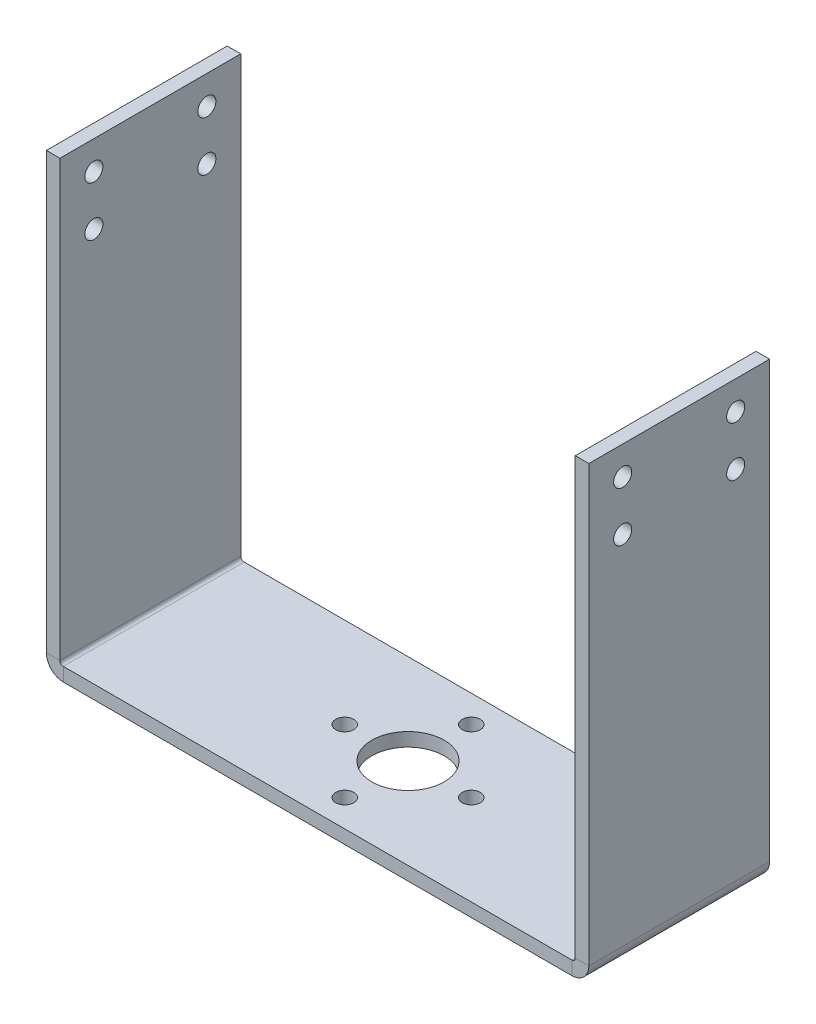
from build123d import *

# Parameters (mm, degrees)
SKETCH3_W                    = 114
SKETCH3_H                    = 40
BASE_FLANGE1_DEPTH           = 3
EDGE_FLANGE1_STRIP_W         = 13.4732
EDGE_FLANGE1_STRIP_H         = 3
EDGE_FLANGE1_STRIP_CUT_DEPTH = 40
EDGE_FLANGE1_DEPTH           = 40
EDGE_FLANGE2_STRIP_W         = 13.4732
EDGE_FLANGE2_STRIP_H         = 3
EDGE_FLANGE2_STRIP_CUT_DEPTH = 40
EDGE_FLANGE2_DEPTH           = 40
SKETCH11_R                   = 8
SKETCH11_R_2                 = 2
CUT_EXTRUDE1_DEPTH           = 10
CUT_EXTRUDE2_REACH           = 157.592
SKETCH12_R                   = 2


# Sheet-metal steps are written as plain solids
with BuildPart() as part:
    # Sketch3 → Base-Flange1 (new body)
    with BuildSketch(Plane(origin=(0, 0, 0), x_dir=(1, 0, 0), z_dir=(0, 1, 0))):
        Rectangle(SKETCH3_W, SKETCH3_H)
    extrude(amount=-BASE_FLANGE1_DEPTH)

    # Edge-Flange1 strip (across the edge) → Edge-Flange1 strip cut (cut)
    with BuildSketch(Plane(origin=(-57, 0, -20), x_dir=(1, 0, 0), z_dir=(0, 0, 1))):
        with Locations((-6, -1.5)):
            Rectangle(EDGE_FLANGE1_STRIP_W, EDGE_FLANGE1_STRIP_H)
    extrude(amount=EDGE_FLANGE1_STRIP_CUT_DEPTH, mode=Mode.SUBTRACT)

    # Edge-Flange1 section (across the edge) → Edge-Flange1 (add)
    with BuildSketch(Plane(origin=(-57, 0, -20), x_dir=(1, 0, 0), z_dir=(0, 0, 1))):
        with BuildLine():
            Line((-3, 0.7366), (-3, 97))
            Line((-3, 97), (0, 97))
            Line((0, 97), (0, 0.7366))
            ThreePointArc((0, 0.7366), (0.215745145, 0.215745145), (0.7366, 0))
            Line((0.7366, 0), (0.7366, -3))
            ThreePointArc((0.7366, -3), (-1.905575199, -1.905575199), (-3, 0.7366))
        make_face()
    extrude(amount=EDGE_FLANGE1_DEPTH)

    # Edge-Flange2 strip (across the edge) → Edge-Flange2 strip cut (cut)
    with BuildSketch(Plane(origin=(57, 0, 20), x_dir=(-1, 0, 0), z_dir=(0, 0, -1))):
        with Locations((-6, -1.5)):
            Rectangle(EDGE_FLANGE2_STRIP_W, EDGE_FLANGE2_STRIP_H)
    extrude(amount=EDGE_FLANGE2_STRIP_CUT_DEPTH, mode=Mode.SUBTRACT)

    # Edge-Flange2 section (across the edge) → Edge-Flange2 (add)
    with BuildSketch(Plane(origin=(57, 0, 20), x_dir=(-1, 0, 0), z_dir=(0, 0, -1))):
        with BuildLine():
            Line((-3, 0.7366), (-3, 97))
            Line((-3, 97), (0, 97))
            Line((0, 97), (0, 0.7366))
            ThreePointArc((0, 0.7366), (0.215745145, 0.215745145), (0.7366, 0))
            Line((0.7366, 0), (0.7366, -3))
            ThreePointArc((0.7366, -3), (-1.905575199, -1.905575199), (-3, 0.7366))
        make_face()
    extrude(amount=EDGE_FLANGE2_DEPTH)

    # Sketch11 → Cut-Extrude1 (cut)
    with BuildSketch(Plane(origin=(0, -3, 0), x_dir=(-1, 0, 0), z_dir=(0, -1, 0))):
        with Locations(Location((0, 0, 0), (0, 0, 90))):
            Circle(SKETCH11_R)
        with Locations(Location((0, 14, 0), (0, 0, 90))):
            Circle(SKETCH11_R_2)
        with Locations(Location((14, 0, 0), (0, 0, 90))):
            Circle(SKETCH11_R_2)
        with Locations(Location((0, -14, 0), (0, 0, 90))):
            Circle(SKETCH11_R_2)
        with Locations(Location((-14, 0, 0), (0, 0, 90))):
            Circle(SKETCH11_R_2)
    extrude(amount=-CUT_EXTRUDE1_DEPTH, mode=Mode.SUBTRACT)

    # Cut-Extrude2: up to this face of the body (flat: up to its plane)
    cut_extrude2_end = Plane(part.part.faces().sort_by_distance((-60, 48.8683, 0))[0])
    # Sketch12 → Cut-Extrude2 (cut, up to the picked face)
    with BuildSketch(Plane(origin=(60, 0, 0), x_dir=(0, 0, -1), z_dir=(1, 0, 0)), mode=Mode.PRIVATE) as cut_extrude2_sk1:
        with Locations(Location((12.5, 79.674243403, 0), (0, 0, 90))):
            Circle(SKETCH12_R)
    cut_extrude2_tool1 = split(extrude(cut_extrude2_sk1.sketch, amount=-CUT_EXTRUDE2_REACH, mode=Mode.PRIVATE), bisect_by=cut_extrude2_end, keep=Keep.BOTH, mode=Mode.PRIVATE)
    # Sketch12 → Cut-Extrude2 (cut, up to the picked face)
    with BuildSketch(Plane(origin=(60, 0, 0), x_dir=(0, 0, -1), z_dir=(1, 0, 0)), mode=Mode.PRIVATE) as cut_extrude2_sk2:
        with Locations(Location((12.5, 90.674243403, 0), (0, 0, 90))):
            Circle(SKETCH12_R)
    cut_extrude2_tool2 = split(extrude(cut_extrude2_sk2.sketch, amount=-CUT_EXTRUDE2_REACH, mode=Mode.PRIVATE), bisect_by=cut_extrude2_end, keep=Keep.BOTH, mode=Mode.PRIVATE)
    # Sketch12 → Cut-Extrude2 (cut, up to the picked face)
    with BuildSketch(Plane(origin=(60, 0, 0), x_dir=(0, 0, -1), z_dir=(1, 0, 0)), mode=Mode.PRIVATE) as cut_extrude2_sk3:
        with Locations(Location((-12.5, 79.674243403, 0), (0, 0, 90))):
            Circle(SKETCH12_R)
    cut_extrude2_tool3 = split(extrude(cut_extrude2_sk3.sketch, amount=-CUT_EXTRUDE2_REACH, mode=Mode.PRIVATE), bisect_by=cut_extrude2_end, keep=Keep.BOTH, mode=Mode.PRIVATE)
    # Sketch12 → Cut-Extrude2 (cut, up to the picked face)
    with BuildSketch(Plane(origin=(60, 0, 0), x_dir=(0, 0, -1), z_dir=(1, 0, 0)), mode=Mode.PRIVATE) as cut_extrude2_sk4:
        with Locations(Location((-12.5, 90.674243403, 0), (0, 0, 90))):
            Circle(SKETCH12_R)
    cut_extrude2_tool4 = split(extrude(cut_extrude2_sk4.sketch, amount=-CUT_EXTRUDE2_REACH, mode=Mode.PRIVATE), bisect_by=cut_extrude2_end, keep=Keep.BOTH, mode=Mode.PRIVATE)
    add(cut_extrude2_tool1.solids().sort_by(Axis((60, 79.674243, -12.5), (-1, 0, 0)))[0], mode=Mode.SUBTRACT)
    add(cut_extrude2_tool2.solids().sort_by(Axis((60, 90.674243, -12.5), (-1, 0, 0)))[0], mode=Mode.SUBTRACT)
    add(cut_extrude2_tool3.solids().sort_by(Axis((60, 79.674243, 12.5), (-1, 0, 0)))[0], mode=Mode.SUBTRACT)
    add(cut_extrude2_tool4.solids().sort_by(Axis((60, 90.674243, 12.5), (-1, 0, 0)))[0], mode=Mode.SUBTRACT)


solid = part.part
